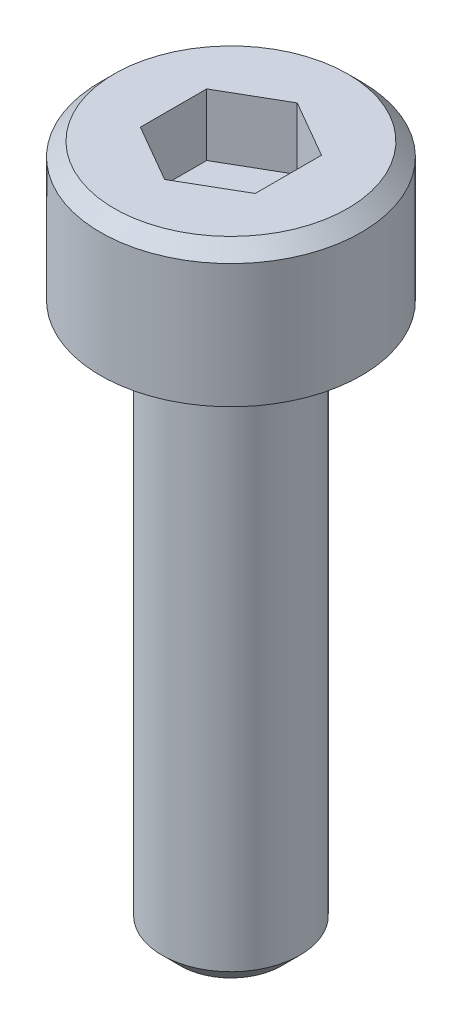
from build123d import *

# Parameters (mm, degrees)
CUT_EXTRUDE1_DEPTH = 1.35


with BuildPart() as part:
    # Sketch1 → Revolve1 (revolve)
    with BuildSketch(Plane.XY):
        Polygon((0, -12), (1.1, -12), (1.5, -11.6), (1.5, 0), (2.84, 0), (2.84, 2.7), (2.54, 3), (0, 3), align=None)
    revolve(axis=Axis((0, -10, 0), (0, 1, 0)))

    # Sketch2 → Cut-Extrude1 (cut)
    with BuildSketch(Plane(origin=(0, 3, 0), x_dir=(1, 0, 0), z_dir=(0, 1, 0))):
        Polygon((1.25, -0.721687836), (0, -1.443375673), (-1.25, -0.721687836), (-1.25, 0.721687836), (0, 1.443375673), (1.25, 0.721687836), align=None)
    extrude(amount=-CUT_EXTRUDE1_DEPTH, mode=Mode.SUBTRACT)


solid = part.part
